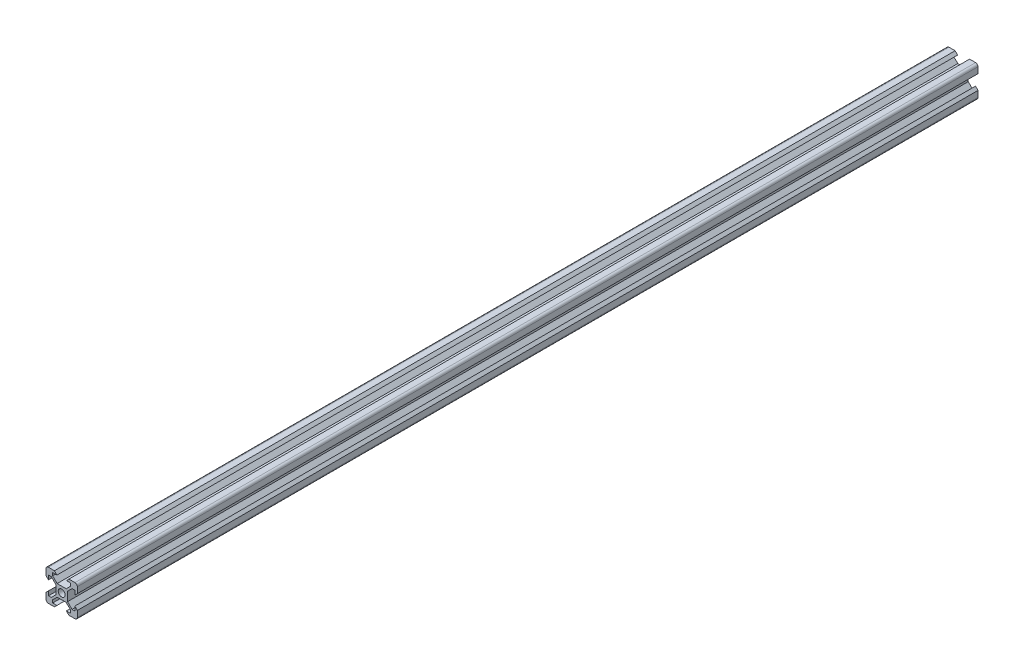
from build123d import *

# Parameters (mm, degrees)
SKETCH1_R           = 4.4
BOSS_EXTRUDE1_DEPTH = 575


with BuildPart() as part:
    # Sketch1 → Boss-Extrude1 (new, symmetric)
    with BuildSketch(Plane.XY):
        with BuildLine():
            Line((-13.271281672, 11.512), (-7.544, 5.784718328))
            Line((-7.544, 5.784718328), (-7.544, -5.784718328))
            Line((-7.544, -5.784718328), (-13.271281672, -11.512))
            Line((-13.271281672, -11.512), (-16.8, -11.512))
            Line((-16.8, -11.512), (-16.8, -6.051976926))
            Line((-16.8, -6.051976926), (-20, -9.251976926))
            Line((-20, -9.251976926), (-20, -17))
            ThreePointArc((-20, -17), (-19.121320344, -19.121320344), (-17, -20))
            Line((-17, -20), (-9.251976926, -20))
            Line((-9.251976926, -20), (-6.051976926, -16.8))
            Line((-6.051976926, -16.8), (-11.512, -16.8))
            Line((-11.512, -16.8), (-11.512, -13.271281672))
            Line((-11.512, -13.271281672), (-5.784718328, -7.544))
            Line((-5.784718328, -7.544), (5.784718328, -7.544))
            Line((5.784718328, -7.544), (11.512, -13.271281672))
            Line((11.512, -13.271281672), (11.512, -16.8))
            Line((11.512, -16.8), (6.051976926, -16.8))
            Line((6.051976926, -16.8), (9.251976926, -20))
            Line((9.251976926, -20), (17, -20))
            ThreePointArc((17, -20), (19.121320344, -19.121320344), (20, -17))
            Line((20, -17), (20, -9.251976926))
            Line((20, -9.251976926), (16.8, -6.051976926))
            Line((16.8, -6.051976926), (16.8, -11.512))
            Line((16.8, -11.512), (13.271281672, -11.512))
            Line((13.271281672, -11.512), (7.544, -5.784718328))
            Line((7.544, -5.784718328), (7.544, 5.784718328))
            Line((7.544, 5.784718328), (13.271281672, 11.512))
            Line((13.271281672, 11.512), (16.8, 11.512))
            Line((16.8, 11.512), (16.8, 6.051976926))
            Line((16.8, 6.051976926), (20, 9.251976926))
            Line((20, 9.251976926), (20, 17))
            ThreePointArc((20, 17), (19.121320344, 19.121320344), (17, 20))
            Line((17, 20), (9.251976926, 20))
            Line((9.251976926, 20), (6.051976926, 16.8))
            Line((6.051976926, 16.8), (11.512, 16.8))
            Line((11.512, 16.8), (11.512, 13.271281672))
            Line((11.512, 13.271281672), (5.784718328, 7.544))
            Line((5.784718328, 7.544), (-5.784718328, 7.544))
            Line((-5.784718328, 7.544), (-11.512, 13.271281672))
            Line((-11.512, 13.271281672), (-11.512, 16.8))
            Line((-11.512, 16.8), (-6.051976926, 16.8))
            Line((-6.051976926, 16.8), (-9.251976926, 20))
            Line((-9.251976926, 20), (-17, 20))
            ThreePointArc((-17, 20), (-19.121320344, 19.121320344), (-20, 17))
            Line((-20, 17), (-20, 9.251976926))
            Line((-20, 9.251976926), (-16.8, 6.051976926))
            Line((-16.8, 6.051976926), (-16.8, 11.512))
            Line((-16.8, 11.512), (-13.271281672, 11.512))
        make_face()
        Circle(SKETCH1_R, mode=Mode.SUBTRACT)
    extrude(amount=BOSS_EXTRUDE1_DEPTH, both=True)


solid = part.part
